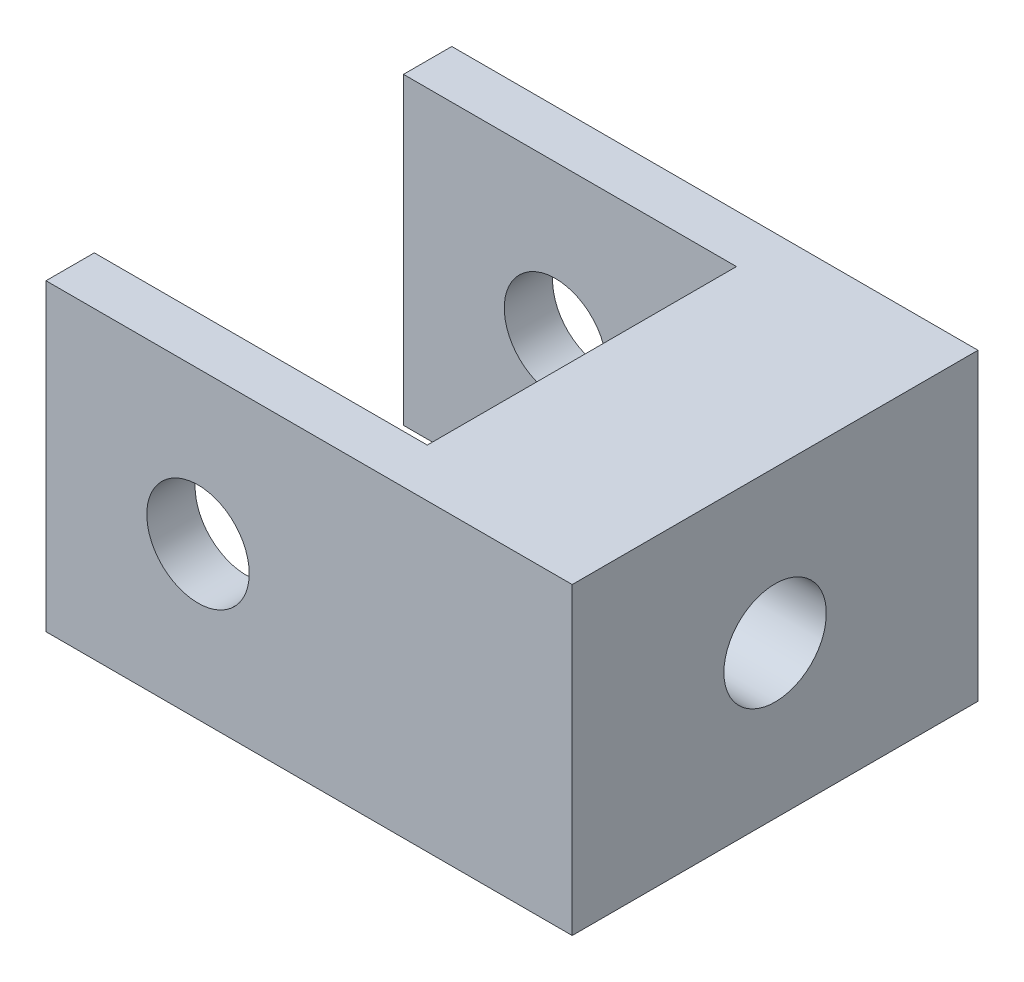
from build123d import *

# Parameters (mm, degrees)
BELT_TENSIONER_SKETCH_W        = 27.232395448
BELT_TENSIONER_SKETCH_H        = 15.732395448
BODY_EXTRUDE_DEPTH             = 10.5
CUT_EXTRUDE1_DEPTH             = 8
CBORE_FOR_M5_SHCS1_D           = 5.3
CBORE_FOR_M5_SHCS1_CBORE_D     = 10
CBORE_FOR_M5_SHCS1_CBORE_DEPTH = 5
M5_CLEARANCE_HOLE1_D           = 5.3


with BuildPart() as part:
    # Belt Tensioner Sketch → Body Extrude (new, symmetric)
    with BuildSketch(Plane.XY):
        with Locations((5.75, 0)):
            Rectangle(BELT_TENSIONER_SKETCH_W, BELT_TENSIONER_SKETCH_H)
    extrude(amount=BODY_EXTRUDE_DEPTH, both=True)

    # Belt Tensioner Sketch<3> → Cut-Extrude1 (cut, symmetric)
    with BuildSketch(Plane.XY):
        Polygon((-7.866197724, -7.866197724), (0, -7.866197724), (9.366197724, -7.866197724), (9.366197724, 7.866197724), (0, 7.866197724), (-7.866197724, 7.866197724), align=None)
    extrude(amount=CUT_EXTRUDE1_DEPTH, both=True, mode=Mode.SUBTRACT)

    # CBORE for M5 SHCS1 (through all)
    with Locations(Plane.ZY.offset(-9.366197724)):
        with Locations((0, 0)):
            CounterBoreHole(CBORE_FOR_M5_SHCS1_D / 2, CBORE_FOR_M5_SHCS1_CBORE_D / 2, CBORE_FOR_M5_SHCS1_CBORE_DEPTH)

    # M5 Clearance Hole1 (through all)
    with Locations(Plane.XY.offset(10.5)):
        with Locations((0, 0)):
            Hole(M5_CLEARANCE_HOLE1_D / 2)


solid = part.part
